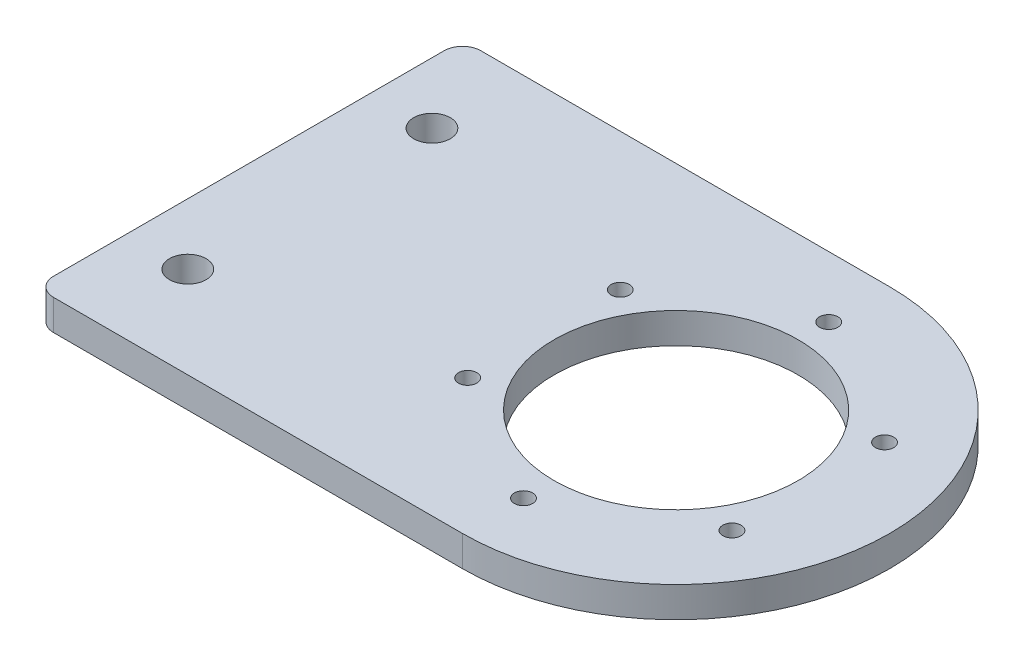
from build123d import *

# Parameters (mm, degrees)
SKETCH1_R           = 1.5
SKETCH1_R_2         = 3
SKETCH1_R_3         = 20
BOSS_EXTRUDE1_DEPTH = 5
FILLET1_R           = 3


with BuildPart() as part:
    # Sketch1 → Boss-Extrude1 (new body)
    with BuildSketch(Plane(origin=(0, 0, 0), x_dir=(1, 0, 0), z_dir=(0, 1, 0))):
        with BuildLine():
            Line((-70, 35), (0, 35))
            ThreePointArc((0, 35), (35, 0), (0, -35))
            Line((0, -35), (-70, -35))
            Line((-70, -35), (-70, 35))
        make_face()
        with Locations((0, 25)):
            Circle(SKETCH1_R, mode=Mode.SUBTRACT)
        with Locations((21.650635095, 12.5)):
            Circle(SKETCH1_R, mode=Mode.SUBTRACT)
        with Locations((21.650635095, -12.5)):
            Circle(SKETCH1_R, mode=Mode.SUBTRACT)
        with Locations((0, -25)):
            Circle(SKETCH1_R, mode=Mode.SUBTRACT)
        with Locations((-21.650635095, -12.5)):
            Circle(SKETCH1_R, mode=Mode.SUBTRACT)
        with Locations((-21.650635095, 12.5)):
            Circle(SKETCH1_R, mode=Mode.SUBTRACT)
        with Locations((-60, 20)):
            Circle(SKETCH1_R_2, mode=Mode.SUBTRACT)
        with Locations((-60, -20)):
            Circle(SKETCH1_R_2, mode=Mode.SUBTRACT)
        Circle(SKETCH1_R_3, mode=Mode.SUBTRACT)
    extrude(amount=BOSS_EXTRUDE1_DEPTH)

    # Fillet1
    fillet1_edges = [part.edges().sort_by_distance(p)[0] for p in [
        (-70, 2.5, 35),
        (-70, 2.5, -35),
    ]]
    fillet(fillet1_edges, radius=FILLET1_R)


solid = part.part
